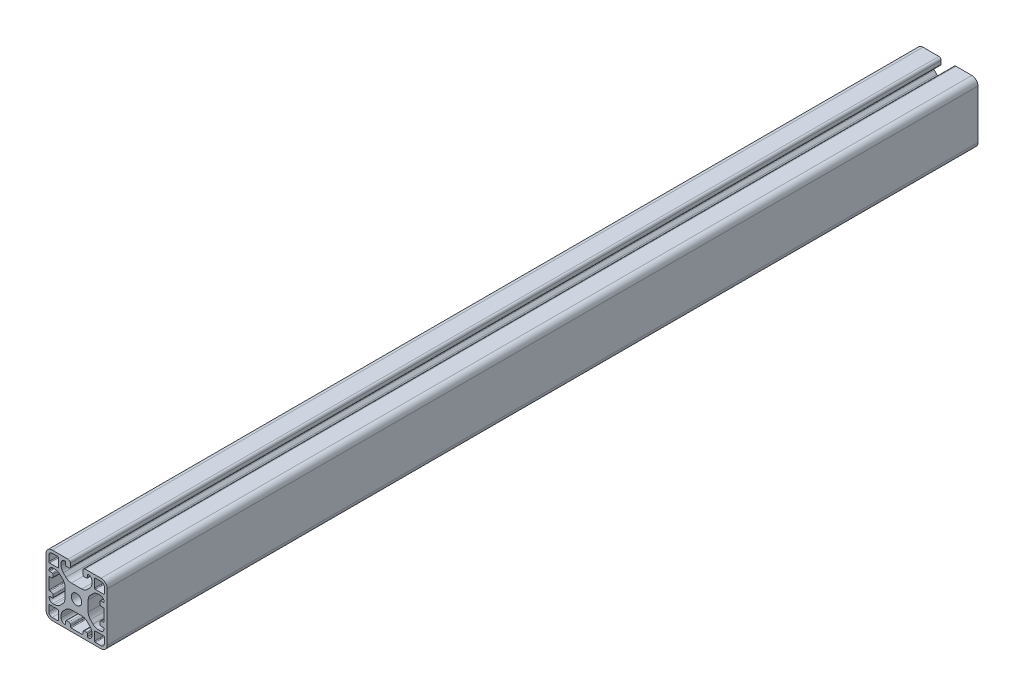
from build123d import *

# Parameters (mm, degrees)
SKIZZE1_R                       = 3.4
AUFSATZ_LINEAR_AUSTRAGEN1_DEPTH = 570


with BuildPart() as part:
    # Skizze1 → Aufsatz-Linear austragen1 (new body)
    with BuildSketch(Plane.XY.offset(570)):
        with BuildLine():
            Line((23.100000014, 35.850000004), (23.100000014, 37.500000007))
            ThreePointArc((23.100000014, 37.500000007), (23.246446625, 37.8535534), (23.600000018, 38.000000007))
            ThreePointArc((23.600000018, 38.000000007), (25.367766957, 37.267766953), (26.099999996, 35.500000007))
            Line((26.099999996, 35.500000007), (26.099999996, 34.292388137))
            ThreePointArc((26.099999996, 34.292388137), (25.719397659, 32.378970975), (24.635533902, 30.756854231))
            Line((24.635533902, 30.756854231), (22.943145774, 29.064466103))
            ThreePointArc((22.943145774, 29.064466103), (21.32102903, 27.980602346), (19.407611868, 27.600000008))
            Line((19.407611868, 27.600000008), (12.592388142, 27.600000008))
            ThreePointArc((12.592388142, 27.600000008), (10.678970981, 27.980602346), (9.056854237, 29.064466102))
            Line((9.056854237, 29.064466102), (7.36446608, 30.75685426))
            ThreePointArc((7.36446608, 30.75685426), (6.280602323, 32.378971004), (5.899999986, 34.292388165))
            Line((5.899999986, 34.292388165), (5.899999986, 35.500000003))
            ThreePointArc((5.899999986, 35.500000003), (6.632233037, 37.267766961), (8.399999999, 38.000000003))
            ThreePointArc((8.399999999, 38.000000003), (8.753553388, 37.853553393), (8.899999996, 37.500000003))
            Line((8.899999996, 37.500000003), (8.899999996, 35.850000004))
            ThreePointArc((8.899999996, 35.850000004), (9.046446605, 35.496446613), (9.399999996, 35.350000004))
            Line((9.399999996, 35.350000004), (10.899999944, 35.350000004))
            ThreePointArc((10.899999944, 35.350000004), (11.607106725, 35.642893223), (11.899999944, 36.350000004))
            Line((11.899999944, 36.350000004), (11.899999944, 38.500000016))
            ThreePointArc((11.899999944, 38.500000016), (11.460660115, 39.560660188), (10.399999943, 40.000000016))
            Line((10.399999943, 40.000000016), (4.8e-08, 40.000000016))
            ThreePointArc((4.8e-08, 40.000000016), (-2.828427121, 38.828427123), (-4.000000014, 35.999999954))
            Line((-4.000000014, 35.999999954), (-4.000000014, 4.000000069))
            ThreePointArc((-4.000000014, 4.000000069), (-2.828427124, 1.171572908), (3.7e-08, 1.8e-08))
            Line((3.7e-08, 1.8e-08), (31.999999922, 1.8e-08))
            ThreePointArc((31.999999922, 1.8e-08), (34.828427083, 1.171572908), (35.999999974, 4.000000069))
            Line((35.999999974, 4.000000069), (35.999999974, 35.999999953))
            ThreePointArc((35.999999974, 35.999999953), (34.82842708, 38.828427122), (31.99999991, 40.000000016))
            Line((31.99999991, 40.000000016), (21.599999961, 40.000000016))
            ThreePointArc((21.599999961, 40.000000016), (20.53933979, 39.560660188), (20.099999962, 38.500000017))
            Line((20.099999962, 38.500000017), (20.099999962, 36.350000004))
            ThreePointArc((20.099999962, 36.350000004), (20.392893181, 35.642893223), (21.099999962, 35.350000004))
            Line((21.099999962, 35.350000004), (22.600000014, 35.350000004))
            ThreePointArc((22.600000014, 35.350000004), (22.953553405, 35.496446613), (23.100000014, 35.850000004))
        make_face()
        with Locations((15.999999985, 20)):
            Circle(SKIZZE1_R, mode=Mode.SUBTRACT)
        with BuildLine():
            Line((4.8e-08, 38.200000033), (3.699999945, 38.200000033))
            ThreePointArc((3.699999945, 38.200000033), (4.053553343, 38.053553421), (4.199999956, 37.700000022))
            Line((4.199999956, 37.700000022), (4.199999956, 32.299999708))
            ThreePointArc((4.199999956, 32.299999708), (4.053553442, 31.946446549), (3.700000282, 31.800000035))
            Line((3.700000282, 31.800000035), (-1.70000008, 31.800000035))
            ThreePointArc((-1.70000008, 31.800000035), (-2.053553436, 31.94644663), (-2.200000031, 32.299999986))
            Line((-2.200000031, 32.299999986), (-2.200000031, 35.999999954))
            ThreePointArc((-2.200000031, 35.999999954), (-1.555634927, 37.555634929), (4.8e-08, 38.200000033))
        make_face(mode=Mode.SUBTRACT)
        with BuildLine():
            Line((-2.200000031, 4.000000069), (-2.200000031, 7.699999986))
            ThreePointArc((-2.200000031, 7.699999986), (-2.053553419, 8.053553385), (-1.70000002, 8.199999998))
            Line((-1.70000002, 8.199999998), (3.700000282, 8.199999998))
            ThreePointArc((3.700000282, 8.199999998), (4.053553442, 8.053553484), (4.199999956, 7.700000324))
            Line((4.199999956, 7.700000324), (4.199999956, 2.299999952))
            ThreePointArc((4.199999956, 2.299999952), (4.053553361, 1.946446596), (3.700000004, 1.800000001))
            Line((3.700000004, 1.800000001), (3.7e-08, 1.800000001))
            ThreePointArc((3.7e-08, 1.800000001), (-1.55563493, 2.444365102), (-2.200000031, 4.000000069))
        make_face(mode=Mode.SUBTRACT)
        with BuildLine():
            Line((31.999999922, 1.800000001), (28.300000004, 1.800000001))
            ThreePointArc((28.300000004, 1.800000001), (27.946446606, 1.946446613), (27.799999993, 2.300000012))
            Line((27.799999993, 2.300000012), (27.799999993, 7.700000324))
            ThreePointArc((27.799999993, 7.700000324), (27.946446507, 8.053553484), (28.299999667, 8.199999998))
            Line((28.299999667, 8.199999998), (33.700000039, 8.199999998))
            ThreePointArc((33.700000039, 8.199999998), (34.053553395, 8.053553402), (34.199999991, 7.700000046))
            Line((34.199999991, 7.700000046), (34.199999991, 4.000000069))
            ThreePointArc((34.199999991, 4.000000069), (33.555634889, 2.444365102), (31.999999922, 1.800000001))
        make_face(mode=Mode.SUBTRACT)
        with BuildLine():
            Line((34.199999991, 35.999999953), (34.199999991, 32.300000046))
            ThreePointArc((34.199999991, 32.300000046), (34.053553378, 31.946446648), (33.699999979, 31.800000035))
            Line((33.699999979, 31.800000035), (28.299999667, 31.800000035))
            ThreePointArc((28.299999667, 31.800000035), (27.946446507, 31.946446549), (27.799999993, 32.299999708))
            Line((27.799999993, 32.299999708), (27.799999993, 37.700000082))
            ThreePointArc((27.799999993, 37.700000082), (27.946446588, 38.053553438), (28.299999945, 38.200000033))
            Line((28.299999945, 38.200000033), (31.99999991, 38.200000033))
            ThreePointArc((31.99999991, 38.200000033), (33.555634886, 37.555634928), (34.199999991, 35.999999953))
        make_face(mode=Mode.SUBTRACT)
        with BuildLine():
            Line((12.592388143, 12.399999997), (19.407611847, 12.399999997))
            ThreePointArc((19.407611847, 12.399999997), (21.321029009, 12.01939766), (22.943145752, 10.935533904))
            Line((22.943145752, 10.935533904), (24.635533902, 9.243145754))
            ThreePointArc((24.635533902, 9.243145754), (25.719397659, 7.62102901), (26.099999996, 5.707611848))
            Line((26.099999996, 5.707611848), (26.099999996, 4.499999993))
            ThreePointArc((26.099999996, 4.499999993), (25.367766957, 2.732233048), (23.600000018, 1.999999995))
            ThreePointArc((23.600000018, 1.999999995), (23.246446625, 2.146446603), (23.100000014, 2.499999995))
            Line((23.100000014, 2.499999995), (23.100000014, 4.149999994))
            ThreePointArc((23.100000014, 4.149999994), (22.953553405, 4.503553383), (22.600000016, 4.649999992))
            Line((22.600000016, 4.649999992), (21.099999962, 4.649999992))
            ThreePointArc((21.099999962, 4.649999992), (20.392893181, 4.357106773), (20.099999962, 3.649999992))
            Line((20.099999962, 3.649999992), (20.099999962, 2.500000006))
            ThreePointArc((20.099999962, 2.500000006), (19.953553353, 2.146446616), (19.599999962, 2.000000006))
            Line((19.599999962, 2.000000006), (12.399999942, 2.000000006))
            ThreePointArc((12.399999942, 2.000000006), (12.046446553, 2.146446615), (11.899999944, 2.500000005))
            Line((11.899999944, 2.500000005), (11.899999944, 3.649999992))
            ThreePointArc((11.899999944, 3.649999992), (11.607106725, 4.357106773), (10.899999943, 4.649999992))
            Line((10.899999943, 4.649999992), (9.399999996, 4.649999992))
            ThreePointArc((9.399999996, 4.649999992), (9.046446606, 4.503553382), (8.899999996, 4.149999992))
            Line((8.899999996, 4.149999992), (8.899999996, 2.499999991))
            ThreePointArc((8.899999996, 2.499999991), (8.753553389, 2.146446604), (8.400000003, 1.999999994))
            ThreePointArc((8.400000003, 1.999999994), (6.632233039, 2.732233035), (5.899999986, 4.499999994))
            Line((5.899999986, 4.499999994), (5.899999986, 5.707611838))
            ThreePointArc((5.899999986, 5.707611838), (6.280602323, 7.621029001), (7.36446608, 9.243145746))
            Line((7.36446608, 9.243145746), (9.056854238, 10.935533903))
            ThreePointArc((9.056854238, 10.935533903), (10.678970982, 12.01939766), (12.592388143, 12.399999997))
        make_face(mode=Mode.SUBTRACT)
        with BuildLine():
            Line((-0.350000011, 15.899999977), (-1.500000012, 15.899999977))
            ThreePointArc((-1.500000012, 15.899999977), (-1.853553403, 16.046446586), (-2.000000012, 16.399999977))
            Line((-2.000000012, 16.399999977), (-2.000000012, 23.599999997))
            ThreePointArc((-2.000000012, 23.599999997), (-1.853553403, 23.953553386), (-1.500000014, 24.099999995))
            Line((-1.500000014, 24.099999995), (-0.350000011, 24.099999995))
            ThreePointArc((-0.350000011, 24.099999995), (0.35710677, 24.392893214), (0.649999989, 25.099999995))
            Line((0.649999989, 25.099999995), (0.649999989, 26.599999997))
            ThreePointArc((0.649999989, 26.599999997), (0.503553379, 26.953553388), (0.149999989, 27.099999997))
            Line((0.149999989, 27.099999997), (-1.500000012, 27.099999997))
            ThreePointArc((-1.500000012, 27.099999997), (-1.853553399, 27.246446604), (-2.000000009, 27.599999991))
            ThreePointArc((-2.000000009, 27.599999991), (-1.267766968, 29.367766955), (0.499999991, 30.100000008))
            Line((0.499999991, 30.100000008), (1.707611836, 30.100000008))
            ThreePointArc((1.707611836, 30.100000008), (3.621028998, 29.71939767), (5.243145743, 28.635533913))
            Line((5.243145743, 28.635533913), (6.935533893, 26.943145763))
            ThreePointArc((6.935533893, 26.943145763), (8.01939765, 25.321029019), (8.399999987, 23.407611857))
            Line((8.399999987, 23.407611857), (8.399999987, 16.592388128))
            ThreePointArc((8.399999987, 16.592388128), (8.01939765, 14.678970966), (6.935533894, 13.056854223))
            Line((6.935533894, 13.056854223), (5.243145736, 11.364466065))
            ThreePointArc((5.243145736, 11.364466065), (3.621028992, 10.280602309), (1.70761183, 9.899999971))
            Line((1.70761183, 9.899999971), (0.49999999, 9.899999971))
            ThreePointArc((0.49999999, 9.899999971), (-1.267766966, 10.632233022), (-2.000000008, 12.399999982))
            ThreePointArc((-2.000000008, 12.399999982), (-1.853553397, 12.753553371), (-1.500000008, 12.899999979))
            Line((-1.500000008, 12.899999979), (0.149999991, 12.899999979))
            ThreePointArc((0.149999991, 12.899999979), (0.50355338, 13.046446588), (0.649999989, 13.399999977))
            Line((0.649999989, 13.399999977), (0.649999989, 14.899999976))
            ThreePointArc((0.649999989, 14.899999976), (0.35710677, 15.607106758), (-0.350000011, 15.899999977))
        make_face(mode=Mode.SUBTRACT)
        with BuildLine():
            Line((23.599999999, 16.592388152), (23.599999999, 23.407611854))
            ThreePointArc((23.599999999, 23.407611854), (23.980602337, 25.321029015), (25.064466093, 26.943145759))
            Line((25.064466093, 26.943145759), (26.756854248, 28.635533914))
            ThreePointArc((26.756854248, 28.635533914), (28.378970992, 29.71939767), (30.292388154, 30.100000008))
            Line((30.292388154, 30.100000008), (31.49999999, 30.100000008))
            ThreePointArc((31.49999999, 30.100000008), (33.267766947, 29.367766956), (33.999999988, 27.599999994))
            ThreePointArc((33.999999988, 27.599999994), (33.853553377, 27.246446605), (33.499999988, 27.099999997))
            Line((33.499999988, 27.099999997), (31.849999989, 27.099999997))
            ThreePointArc((31.849999989, 27.099999997), (31.4964466, 26.953553388), (31.349999991, 26.6))
            Line((31.349999991, 26.6), (31.349999991, 25.099999995))
            ThreePointArc((31.349999991, 25.099999995), (31.64289321, 24.392893214), (32.349999991, 24.099999995))
            Line((32.349999991, 24.099999995), (33.499999986, 24.099999995))
            ThreePointArc((33.499999986, 24.099999995), (33.853553377, 23.953553386), (33.999999986, 23.599999995))
            Line((33.999999986, 23.599999995), (33.999999986, 16.399999975))
            ThreePointArc((33.999999986, 16.399999975), (33.853553377, 16.046446586), (33.499999988, 15.899999977))
            Line((33.499999988, 15.899999977), (32.349999991, 15.899999977))
            ThreePointArc((32.349999991, 15.899999977), (31.64289321, 15.607106758), (31.349999991, 14.899999977))
            Line((31.349999991, 14.899999977), (31.349999991, 13.39999998))
            ThreePointArc((31.349999991, 13.39999998), (31.496446601, 13.046446589), (31.849999991, 12.899999979))
            Line((31.849999991, 12.899999979), (33.499999992, 12.899999979))
            ThreePointArc((33.499999992, 12.899999979), (33.85355338, 12.753553372), (33.999999989, 12.399999985))
            ThreePointArc((33.999999989, 12.399999985), (33.267766947, 10.632233023), (31.499999989, 9.899999971))
            Line((31.499999989, 9.899999971), (30.292388181, 9.899999971))
            ThreePointArc((30.292388181, 9.899999971), (28.378971018, 10.280602309), (26.756854273, 11.364466066))
            Line((26.756854273, 11.364466066), (25.064466093, 13.056854246))
            ThreePointArc((25.064466093, 13.056854246), (23.980602337, 14.67897099), (23.599999999, 16.592388152))
        make_face(mode=Mode.SUBTRACT)
    extrude(amount=-AUFSATZ_LINEAR_AUSTRAGEN1_DEPTH)


solid = part.part
